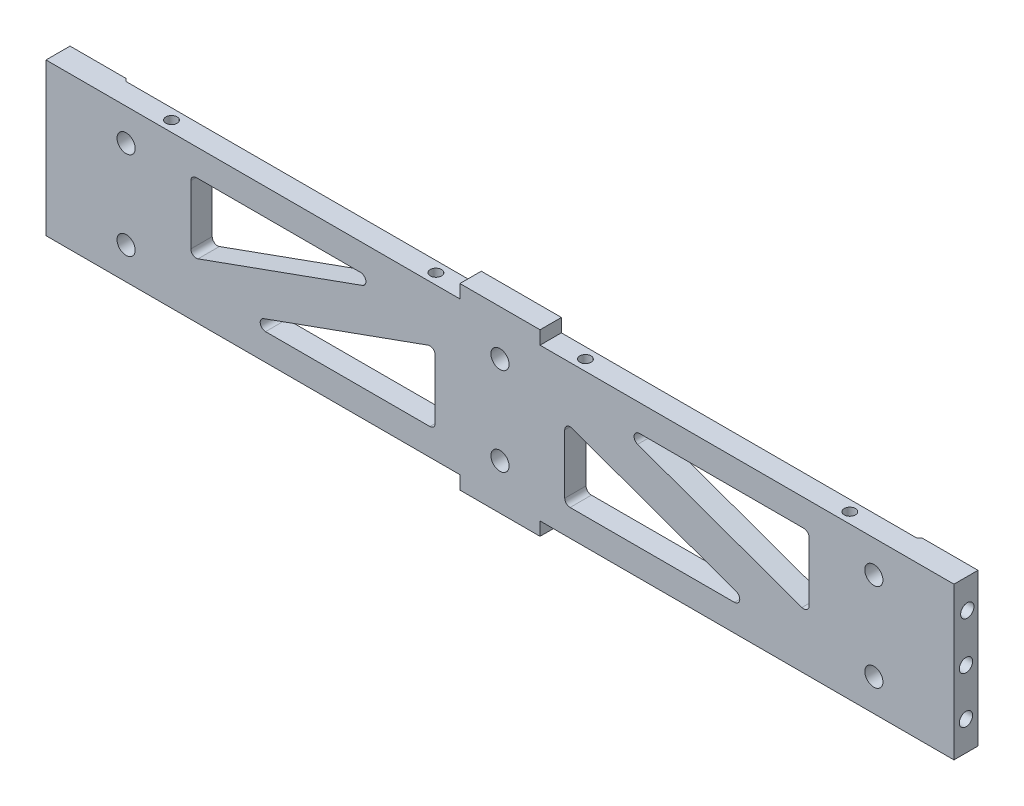
from build123d import *

# Parameters (mm, degrees)
RESSALTO_EXTRUS_O1_DEPTH                    = 8
BROCA_DE_ROSQUEAR_PARA_TARRAXA_DE_M82_D     = 6.8
ESBO_O8_W                                   = 28
ESBO_O8_H                                   = 57
RESSALTO_EXTRUS_O2_DEPTH                    = 1
BROCA_DE_ROSQUEAR_PARA_TARRAXA_DE_M61_D     = 5
BROCA_DE_ROSQUEAR_PARA_TARRAXA_DE_M61_DEPTH = 15
BROCA_DE_ROSQUEAR_PARA_TARRAXA_DE_M61_TIP   = 1.502151548
BROCA_DE_ROSQUEAR_PARA_TARRAXA_DE_M62_D     = 5
BROCA_DE_ROSQUEAR_PARA_TARRAXA_DE_M62_DEPTH = 15
BROCA_DE_ROSQUEAR_PARA_TARRAXA_DE_M62_TIP   = 1.502151548
CHANFRO2_SIZE                               = 7
CHANFRO3_SIZE                               = 7
CORTE_EXTRUS_O1_DEPTH                       = 10
FILETE1_R                                   = 2
BROCA_DE_ROSQUEAR_PARA_TARRAXA_DE_M51_D     = 4.2
BROCA_DE_ROSQUEAR_PARA_TARRAXA_DE_M51_DEPTH = 15
BROCA_DE_ROSQUEAR_PARA_TARRAXA_DE_M51_TIP   = 1.2618073
BROCA_DE_ROSQUEAR_PARA_TARRAXA_DE_M52_D     = 4.2
BROCA_DE_ROSQUEAR_PARA_TARRAXA_DE_M52_DEPTH = 15
BROCA_DE_ROSQUEAR_PARA_TARRAXA_DE_M52_TIP   = 1.2618073
FILETE2_R                                   = 2


with BuildPart() as part:
    # Esboço1 → Ressalto-extrusão1 (new body)
    with BuildSketch(Plane.XY):
        Polygon((185, 57), (185, 62), (155, 62), (155, 57), (0, 57), (0, 0), (155, 0), (155, -5), (185, -5), (185, 0), (340, 0), (340, 57), align=None)
    extrude(amount=RESSALTO_EXTRUS_O1_DEPTH)

    # Broca de rosquear para tarraxa de M82 (through all)
    with Locations(Plane.XY.offset(8)):
        with Locations((30, 45), (30, 12), (170, 45), (170, 12), (310, 45), (310, 12)):
            Hole(BROCA_DE_ROSQUEAR_PARA_TARRAXA_DE_M82_D / 2)

    # Esboço8 → Ressalto-extrusão2 (add)
    with BuildSketch(Plane(origin=(0, 0, 0), x_dir=(-1, 0, 0), z_dir=(0, 0, -1))):
        with Locations((-326, 28.5)):
            Rectangle(ESBO_O8_W, ESBO_O8_H)
        with Locations((-14, 28.5)):
            Rectangle(ESBO_O8_W, ESBO_O8_H)
    extrude(amount=RESSALTO_EXTRUS_O2_DEPTH)

    # Broca de rosquear para tarraxa de M61
    with Locations(Plane(origin=(340, 0, 0), x_dir=(0, 0, -1), z_dir=(1, 0, 0))):
        with Locations((-3, 46), (-3.5, 28.5), (-3.5, 11)):
            Hole(BROCA_DE_ROSQUEAR_PARA_TARRAXA_DE_M61_D / 2, depth=BROCA_DE_ROSQUEAR_PARA_TARRAXA_DE_M61_DEPTH)
            with Locations((0, 0, -(BROCA_DE_ROSQUEAR_PARA_TARRAXA_DE_M61_DEPTH + BROCA_DE_ROSQUEAR_PARA_TARRAXA_DE_M61_TIP / 2))):  # 118° drill point
                Cone(0, BROCA_DE_ROSQUEAR_PARA_TARRAXA_DE_M61_D / 2, BROCA_DE_ROSQUEAR_PARA_TARRAXA_DE_M61_TIP, mode=Mode.SUBTRACT)

    # Broca de rosquear para tarraxa de M62
    with Locations(Plane.ZY):
        with Locations((3, 46), (3, 11), (3, 28.5)):
            Hole(BROCA_DE_ROSQUEAR_PARA_TARRAXA_DE_M62_D / 2, depth=BROCA_DE_ROSQUEAR_PARA_TARRAXA_DE_M62_DEPTH)
            with Locations((0, 0, -(BROCA_DE_ROSQUEAR_PARA_TARRAXA_DE_M62_DEPTH + BROCA_DE_ROSQUEAR_PARA_TARRAXA_DE_M62_TIP / 2))):  # 118° drill point
                Cone(0, BROCA_DE_ROSQUEAR_PARA_TARRAXA_DE_M62_D / 2, BROCA_DE_ROSQUEAR_PARA_TARRAXA_DE_M62_TIP, mode=Mode.SUBTRACT)

    # Chanfro2
    # the kernel refuses this chamfer: 7 mm, written as the material it takes off along each edge
    with BuildSketch(Plane(origin=(28, -18.001780916, -1), x_dir=(0.02749587661058661, 0, 0.9996219169112968), z_dir=(0, 1, 0))) as chanfro2_piece_1_section:
        Polygon((CHANFRO2_SIZE * 0.999621916911, -CHANFRO2_SIZE * 0.0274958766106), (-CHANFRO2_SIZE * 0.0274958766106, -CHANFRO2_SIZE * 0.999621916911), (0, 0), align=None)
    chanfro2_piece_1 = extrude(amount=93.003561832, mode=Mode.PRIVATE)
    chanfro2_piece_1 = split(chanfro2_piece_1, bisect_by=Plane(origin=(24.64888361, 28.5, 0), z_dir=(0, 0, -1)), keep=Keep.TOP, mode=Mode.PRIVATE)
    add(chanfro2_piece_1, mode=Mode.SUBTRACT)

    # Chanfro3
    # the kernel refuses this chamfer: 7 mm, written as the material it takes off along each edge
    with BuildSketch(Plane(origin=(312, -18.001780916, -1), x_dir=(-0.027495876610590064, 0, 0.9996219169112966), z_dir=(0, 1, 0))) as chanfro3_piece_1_section:
        Polygon((CHANFRO3_SIZE * 0.999621916911, CHANFRO3_SIZE * 0.0274958766106), (-CHANFRO3_SIZE * 0.0274958766106, CHANFRO3_SIZE * 0.999621916911), (0, 0), align=None)
    chanfro3_piece_1 = extrude(amount=93.003561832, mode=Mode.PRIVATE)
    chanfro3_piece_1 = split(chanfro3_piece_1, bisect_by=Plane(origin=(315.35111639, 28.5, 0), z_dir=(0, 0, -1)), keep=Keep.TOP, mode=Mode.PRIVATE)
    add(chanfro3_piece_1, mode=Mode.SUBTRACT)

    # Esboço10 → Corte-extrusão1 (cut)
    with BuildSketch(Plane(origin=(0, 0, 0), x_dir=(-1, 0, 0), z_dir=(0, 0, -1))):
        Polygon((-285.753328204, 47), (-210.753328204, 47), (-285.753328204, 20), align=None)
        Polygon((-269.246671796, 10), (-194.246671796, 37), (-194.246671796, 10), align=None)
        Polygon((-145.753328204, 10), (-70.753328204, 10), (-145.753328204, 37), align=None)
        Polygon((-54.246671796, 20), (-54.246671796, 47), (-129.246671796, 47), align=None)
    extrude(amount=-CORTE_EXTRUS_O1_DEPTH, mode=Mode.SUBTRACT)

    # Filete1
    filete1_edges = [part.edges().sort_by_distance(p)[0] for p in [
        (194.246671796, 10, 4),
        (269.246671796, 10, 4),
        (194.246671796, 37, 4),
        (285.753328204, 20, 4),
        (285.753328204, 47, 4),
        (210.753328204, 47, 4),
    ]]
    fillet(filete1_edges, radius=FILETE1_R)

    # Broca de rosquear para tarraxa de M51
    with Locations(Plane(origin=(0, 57, 0), x_dir=(1, 0, 0), z_dir=(0, 1, 0))):
        with Locations((43, -4), (142, -4), (198, -4), (297, -4)):
            Hole(BROCA_DE_ROSQUEAR_PARA_TARRAXA_DE_M51_D / 2, depth=BROCA_DE_ROSQUEAR_PARA_TARRAXA_DE_M51_DEPTH)
            with Locations((0, 0, -(BROCA_DE_ROSQUEAR_PARA_TARRAXA_DE_M51_DEPTH + BROCA_DE_ROSQUEAR_PARA_TARRAXA_DE_M51_TIP / 2))):  # 118° drill point
                Cone(0, BROCA_DE_ROSQUEAR_PARA_TARRAXA_DE_M51_D / 2, BROCA_DE_ROSQUEAR_PARA_TARRAXA_DE_M51_TIP, mode=Mode.SUBTRACT)

    # Broca de rosquear para tarraxa de M52
    with Locations(Plane(origin=(0, 0, 0), x_dir=(-1, 0, 0), z_dir=(0, -1, 0))):
        with Locations((-150, -4), (-190, -4), (-297, -4), (-43, -4), (-272, -4), (-68, -4)):
            Hole(BROCA_DE_ROSQUEAR_PARA_TARRAXA_DE_M52_D / 2, depth=BROCA_DE_ROSQUEAR_PARA_TARRAXA_DE_M52_DEPTH)
            with Locations((0, 0, -(BROCA_DE_ROSQUEAR_PARA_TARRAXA_DE_M52_DEPTH + BROCA_DE_ROSQUEAR_PARA_TARRAXA_DE_M52_TIP / 2))):  # 118° drill point
                Cone(0, BROCA_DE_ROSQUEAR_PARA_TARRAXA_DE_M52_D / 2, BROCA_DE_ROSQUEAR_PARA_TARRAXA_DE_M52_TIP, mode=Mode.SUBTRACT)

    # Filete2
    filete2_edges = [part.edges().sort_by_distance(p)[0] for p in [
        (145.753328204, 10, 4),
        (145.753328204, 37, 4),
        (70.753328204, 10, 4),
        (54.246671796, 20, 4),
        (129.246671796, 47, 4),
        (54.246671796, 47, 4),
    ]]
    fillet(filete2_edges, radius=FILETE2_R)


solid = part.part
